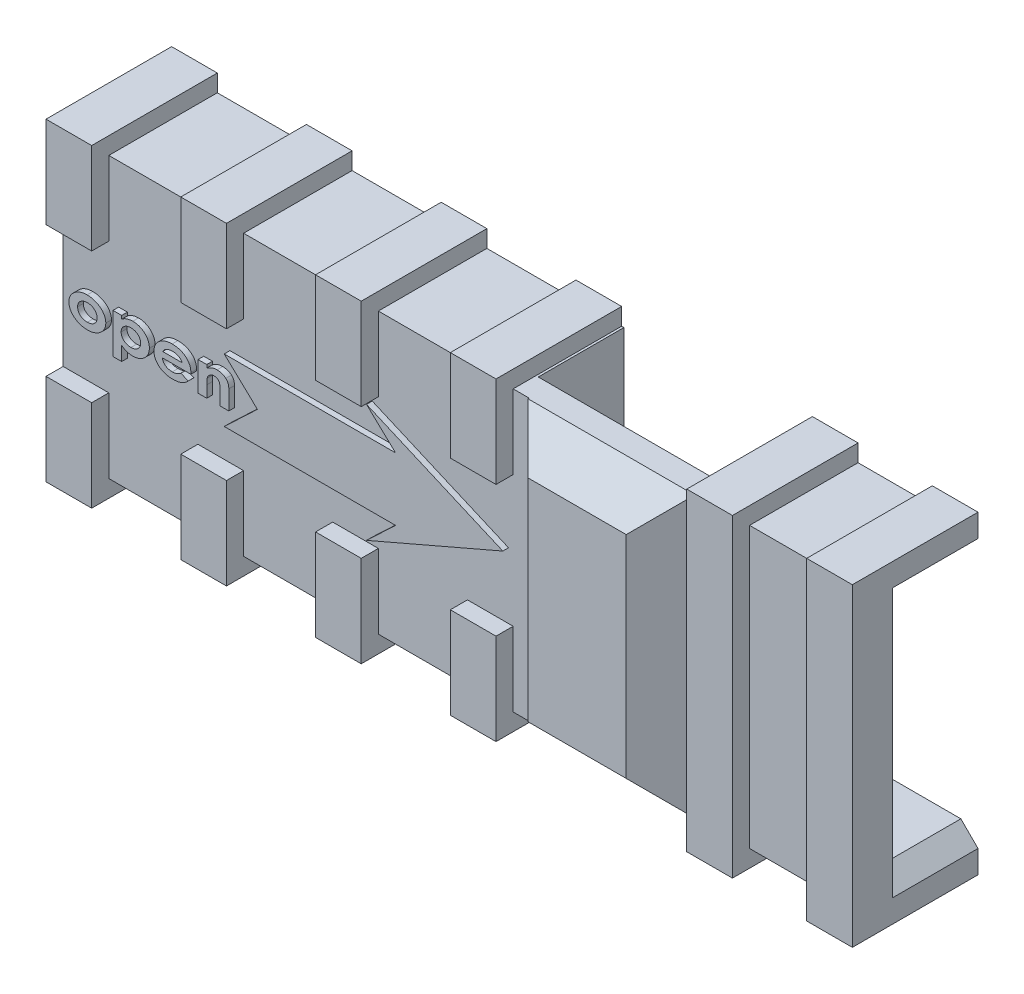
from build123d import *

# Parameters (mm, degrees)
SKETCH1_W                = 55.6
SKETCH1_H                = 24.5
BOSS_EXTRUDE1_DEPTH      = 4.75
SKETCH2_W                = 14.6
SKETCH2_H                = 24.491460156
BOSS_EXTRUDE2_DEPTH      = 3.1
CHAMFER1_SIZE            = 3
SHELL1_T                 = -2
SKETCH3_W                = 16
SKETCH3_H                = 7.5
CUT_EXTRUDE1_DEPTH       = 5.1
SKETCH4_W                = 25
SKETCH4_H                = 3.2
BOSS_EXTRUDE3_DEPTH      = 7.5
SKETCH5_W                = 5.5
SKETCH5_H                = 1.2
CUT_EXTRUDE2_DEPTH       = 43.751900543
BOSS_EXTRUDE6_DEPTH      = 1
BOSS_EXTRUDE6_DEPTH_BACK = 0.8
CUT_EXTRUDE4_DEPTH       = 53.458030844
CHAMFER2_SIZE            = 1.5
BOSS_EXTRUDE7_DEPTH      = 35
FILLET1_R                = 1.5
BOSS_EXTRUDE8_DEPTH      = 0.5
BOSS_EXTRUDE9_DEPTH      = 0.5
SKETCH14_W               = 25
SKETCH14_H               = 1.2
CUT_EXTRUDE5_DEPTH       = 0.3
BOSS_EXTRUDE11_DEPTH     = 25
BOSS_EXTRUDE12_DEPTH     = 25
SKETCH18_W               = 1.3
SKETCH18_H               = 7.95
BOSS_EXTRUDE13_DEPTH     = 8.5
BOSS_EXTRUDE14_DEPTH     = 15
BOSS_EXTRUDE15_DEPTH     = 4
LPATTERN1_START          = -4.75
LPATTERN1_OUTLINE_W      = 4
LPATTERN1_OUTLINE_H      = 1.5
LPATTERN1_DEPTH          = 11
LPATTERN1_START_2        = 4.75
LPATTERN1_2_OUTLINE_W    = 4
LPATTERN1_2_OUTLINE_H    = 6.5
LPATTERN1_2_DEPTH        = 1.5
BOSS_EXTRUDE16_DEPTH     = 4
LPATTERN2_COUNT          = 2
LPATTERN2_PITCH          = 10.5
CHAMFER3_SIZE            = 1.5


# Read off the part's stored shape, not the designer's step: LPattern1
with BuildPart() as part:
    # Sketch1 → Boss-Extrude1 (new, symmetric)
    with BuildSketch(Plane.XY):
        Rectangle(SKETCH1_W, SKETCH1_H)
    extrude(amount=BOSS_EXTRUDE1_DEPTH, both=True)

    # Sketch2 → Boss-Extrude2 (add)
    with BuildSketch(Plane.XY.offset(4.75)):
        with Locations((20.3, 0.004269922)):
            Rectangle(SKETCH2_W, SKETCH2_H)
    extrude(amount=BOSS_EXTRUDE2_DEPTH)

    # Chamfer1
    chamfer1_edges = [part.edges().sort_by_distance(p)[0] for p in [
        (27.6, 0.004269922, 7.85),
        (20.3, 12.25, 7.85),
        (13, 0.004269922, 7.85),
        (20.3, -12.241460156, 7.85),
    ]]
    chamfer(chamfer1_edges, length=CHAMFER1_SIZE)

    # Shell1
    shell1_openings = [part.faces().sort_by_distance(p)[0] for p in [
        (0, 0, -4.75),
        (27.8, 0, 0),
        (-27.8, 0, 0),
    ]]
    offset(amount=SHELL1_T, openings=shell1_openings, kind=Kind.INTERSECTION)

    # Sketch3 → Cut-Extrude1 (cut)
    with BuildSketch(Plane(origin=(0, 12.25, 0), x_dir=(1, 0, 0), z_dir=(0, 1, 0))):
        with Locations((19.8, 1)):
            Rectangle(SKETCH3_W, SKETCH3_H)
    extrude(amount=-CUT_EXTRUDE1_DEPTH, mode=Mode.SUBTRACT)

    # Sketch4 → Boss-Extrude3 (add)
    with BuildSketch(Plane(origin=(0, 0, 2.75), x_dir=(-1, 0, 0), z_dir=(0, 0, -1))):
        with Locations((-0.1, 1.65)):
            Rectangle(SKETCH4_W, SKETCH4_H)
    extrude(amount=BOSS_EXTRUDE3_DEPTH)

    # Sketch5 → Cut-Extrude2 (cut, through all)
    with BuildSketch(Plane.ZY.offset(12.4)):
        with Locations((0, 0.65)):
            Rectangle(SKETCH5_W, SKETCH5_H)
        Polygon((-4.75, 0.05), (-2.863092511, 0.05), (-4.75, 0.884231847), align=None)
        Polygon((-2.75, -0.529898169), (-2.75, 0), (-2.863092511, 0.05), (-4.75, 0.05), (-4.75, -0.529898169), align=None)
    extrude(amount=-CUT_EXTRUDE2_DEPTH, mode=Mode.SUBTRACT)

    # Sketch9 → Boss-Extrude6 (add, two sides: drawn at the far end of the back side and taken through both)
    with BuildSketch(Plane.XZ.offset(-10.25).offset(-BOSS_EXTRUDE6_DEPTH_BACK)):
        Polygon((11.8, 2.75), (11.8, -4.75), (-12.4, -4.75), (-22.6, -4.75), (-22.6, -2.25), (-12.4, -2.25), (-12.4, 2.75), align=None)
    extrude(amount=BOSS_EXTRUDE6_DEPTH + BOSS_EXTRUDE6_DEPTH_BACK)

    # Sketch10 → Cut-Extrude4 (cut, through all)
    with BuildSketch(Plane.ZY.offset(22.6)):
        Polygon((-2.25, 9.25), (-4.75, 10.223803857), (-4.75, 9.25), align=None)
    extrude(amount=-CUT_EXTRUDE4_DEPTH, mode=Mode.SUBTRACT)

    # Chamfer2
    chamfer2_edges = [part.edges().sort_by_distance(p)[0] for p in [
        (-27.8, 10.25, -1),
    ]]
    chamfer(chamfer2_edges, length=CHAMFER2_SIZE)

    # Sketch11 → Boss-Extrude7 (add)
    with BuildSketch(Plane(origin=(12.6, 0, 0), x_dir=(0, 0, -1), z_dir=(1, 0, 0))):
        Polygon((2.55, -10.25), (2.55, -9.25), (4.75, -10.25), (4.75, -10.75), (2.55, -10.75), align=None)
    extrude(amount=-BOSS_EXTRUDE7_DEPTH)

    # Fillet1
    fillet1_edges = [part.edges().sort_by_distance(p)[0] for p in [
        (0.1, 3.25, 2.75),
    ]]
    fillet(fillet1_edges, radius=FILLET1_R)

    # Sketch12 → Boss-Extrude8 (add)
    with BuildSketch(Plane.XY.offset(4.75)):
        Polygon((-13.195407546, 2.75), (1.804592454, 2.75), (-0.737052867, 5.15625), (11.196642534, 0), (-0.737052867, -5.15625), (1.804592454, -2.75), (-13.195407546, -2.75), (-10.290670037, 0), align=None)
    extrude(amount=BOSS_EXTRUDE8_DEPTH)

    # Sketch13 → Boss-Extrude9 (add)
    # profile 1 of 4: a face of its own
    with BuildSketch(Plane.XY.offset(4.75)):
        with BuildLine():
            add(Edge.make_bspline(
                [(-25.198543535, 1.227564103), (-25.16253706, 1.227026087), (-25.090893167, 1.22595557), (-24.984155569, 1.217316685), (-24.879150552, 1.203143918), (-24.775532798, 1.184562687), (-24.673793293, 1.159050398), (-24.573733894, 1.128105432), (-24.474918114, 1.092537833), (-24.379032437, 1.050362204), (-24.285903707, 1.004480708), (-24.197466101, 0.954149845), (-24.114788959, 0.8992749), (-24.036821025, 0.841029499), (-23.965243494, 0.77760954), (-23.896985694, 0.711902981), (-23.835623535, 0.640874275), (-23.77954312, 0.566538171), (-23.729111603, 0.489876202), (-23.685419495, 0.410828996), (-23.648258435, 0.330498826), (-23.617893053, 0.248423141), (-23.593903929, 0.165044822), (-23.577092027, 0.079910674), (-23.567107315, -0.006638519), (-23.565658141, -0.064811429), (-23.564929753, -0.094050481)],
                knots=[0, 0, 0, 0, 1.11282745, 2.214248718, 3.3073953, 4.387044838, 5.466283472, 6.547068225, 7.623401901, 8.710421146, 9.782966613, 10.83127689, 11.853068892, 12.848501143, 13.836567125, 14.807129212, 15.774810607, 16.734124436, 17.683816456, 18.608564961, 19.523271112, 20.416941416, 21.310961996, 22.202059403, 23.096313424, 24, 24, 24, 24], degree=3))
            add(Edge.make_bspline(
                [(-23.564929753, -0.094050481), (-23.565658886, -0.123522776), (-23.567109571, -0.182160874), (-23.577083434, -0.269412481), (-23.593932846, -0.355231243), (-23.617857089, -0.439652501), (-23.648835931, -0.522296335), (-23.686280019, -0.603647308), (-23.73067421, -0.683323032), (-23.780567508, -0.761832753), (-23.837847888, -0.836209358), (-23.898296683, -0.908424722), (-23.965731888, -0.974798028), (-24.036827534, -1.038211293), (-24.113658215, -1.096181697), (-24.194830668, -1.150573418), (-24.280797681, -1.201063663), (-24.371851953, -1.246341287), (-24.466309772, -1.286726694), (-24.563246718, -1.322860459), (-24.662817669, -1.352839177), (-24.764852418, -1.377510198), (-24.869274128, -1.396415747), (-24.976039807, -1.409410625), (-25.085044146, -1.418361582), (-25.158561302, -1.419364578), (-25.195739048, -1.419871795)],
                knots=[0, 0, 0, 0, 0.909223817, 1.808992312, 2.705519222, 3.604825348, 4.512876213, 5.425894602, 6.3650458, 7.325083872, 8.292727501, 9.259376648, 10.228094243, 11.208918944, 12.1967683, 13.194671296, 14.222322225, 15.270311755, 16.329748051, 17.390557501, 18.460346683, 19.535879317, 20.627723368, 21.732231364, 22.853185712, 24, 24, 24, 24], degree=3))
            add(Edge.make_bspline(
                [(-25.195739048, -1.419871795), (-25.2500033, -1.418574177), (-25.356714026, -1.416022409), (-25.513911629, -1.398408376), (-25.664938705, -1.368258362), (-25.809946748, -1.326132893), (-25.949031701, -1.272025256), (-26.081534234, -1.205008624), (-26.208782749, -1.126904659), (-26.327888138, -1.037095232), (-26.437640011, -0.939628116), (-26.532708094, -0.834339769), (-26.614113203, -0.724775746), (-26.680728484, -0.609626994), (-26.732299532, -0.4890704), (-26.768509138, -0.363294339), (-26.792235945, -0.232598734), (-26.794533558, -0.143467517), (-26.795698984, -0.098257212)],
                knots=[0, 0, 0, 0, 1.13037456, 2.222883093, 3.290371038, 4.334986959, 5.364770941, 6.394646991, 7.424235301, 8.470993352, 9.498380662, 10.477280453, 11.420855446, 12.336949679, 13.242176764, 14.145017838, 15.059091615, 16, 16, 16, 16], degree=3))
            add(Edge.make_bspline(
                [(-26.795698984, -0.098257212), (-26.794076245, -0.05000875), (-26.790880031, 0.045023472), (-26.765712661, 0.184317199), (-26.72411595, 0.317451552), (-26.665331659, 0.444255163), (-26.590449772, 0.565210786), (-26.498255499, 0.678971699), (-26.390368447, 0.787398087), (-26.308453541, 0.851677885), (-26.266352028, 0.884715545)],
                knots=[0, 0, 0, 0, 0.996992023, 1.963717908, 2.915734652, 3.873423307, 4.845483175, 5.849056382, 6.894487165, 8, 8, 8, 8], degree=3))
            add(Edge.make_bspline(
                [(-26.266352028, 0.884715545), (-26.227314474, 0.912302797), (-26.149879894, 0.967024649), (-26.026254798, 1.036154717), (-25.89904477, 1.095352543), (-25.767404595, 1.144192023), (-25.631186029, 1.181006296), (-25.490815741, 1.207762634), (-25.346172622, 1.224267869), (-25.248132746, 1.226456884), (-25.198543535, 1.227564103)],
                knots=[0, 0, 0, 0, 1.004823229, 1.993159313, 2.974022723, 3.953813955, 4.942382268, 5.938256273, 6.957156536, 8, 8, 8, 8], degree=3))
        make_face()
        with BuildLine():
            add(Edge.make_bspline(
                [(-25.181716612, 0.644230769), (-25.211644275, 0.643427177), (-25.270236367, 0.641853912), (-25.356281356, 0.633358971), (-25.437847515, 0.615719999), (-25.516317275, 0.593919259), (-25.590518964, 0.563782741), (-25.662172183, 0.529340488), (-25.728446066, 0.485932389), (-25.790761498, 0.437850795), (-25.847711197, 0.385047387), (-25.896495939, 0.327073848), (-25.939657373, 0.266797502), (-25.972948967, 0.201490544), (-26.000107628, 0.133298854), (-26.018696967, 0.060961246), (-26.031308026, -0.014614744), (-26.032350623, -0.066420144), (-26.032878471, -0.092648237)],
                knots=[0, 0, 0, 0, 1.141407707, 2.234637035, 3.290140179, 4.319480612, 5.335428471, 6.339624966, 7.345598836, 8.349043939, 9.338746116, 10.299423449, 11.233789626, 12.158418107, 13.086688811, 14.026857639, 15.001035382, 16, 16, 16, 16], degree=3))
            add(Edge.make_bspline(
                [(-26.032878471, -0.092648237), (-26.032288374, -0.119798495), (-26.031133339, -0.17294148), (-26.019640418, -0.250528929), (-26.000692414, -0.324134031), (-25.973971094, -0.393710765), (-25.939884429, -0.459377519), (-25.899292228, -0.521813401), (-25.849662896, -0.579122107), (-25.793547238, -0.632436428), (-25.731773387, -0.68038569), (-25.665048751, -0.721900757), (-25.594991734, -0.758109179), (-25.520286037, -0.786552676), (-25.441973545, -0.809146052), (-25.359669113, -0.82537536), (-25.273289638, -0.834213415), (-25.214454312, -0.835754444), (-25.184521099, -0.836538462)],
                knots=[0, 0, 0, 0, 1.029202734, 2.014526202, 2.96696449, 3.90694664, 4.834644214, 5.768882826, 6.724574225, 7.702694354, 8.700931557, 9.684698777, 10.679743001, 11.687186518, 12.711184654, 13.768146065, 14.864516221, 16, 16, 16, 16], degree=3))
            add(Edge.make_bspline(
                [(-25.184521099, -0.836538462), (-25.154579114, -0.835838419), (-25.095701043, -0.834461852), (-25.009192675, -0.824399847), (-24.92640436, -0.808417825), (-24.84736289, -0.786202189), (-24.772682958, -0.756316074), (-24.701681441, -0.720665957), (-24.634459746, -0.67824315), (-24.571956407, -0.629423754), (-24.514653308, -0.575925866), (-24.464261588, -0.518108673), (-24.422080139, -0.456117728), (-24.387465763, -0.390519744), (-24.360585943, -0.321349111), (-24.341914343, -0.248364245), (-24.329288575, -0.17184586), (-24.328268779, -0.119343136), (-24.327750266, -0.092648237)],
                knots=[0, 0, 0, 0, 1.131896637, 2.225767246, 3.288061208, 4.317317735, 5.324799949, 6.324580361, 7.317425251, 8.324907466, 9.318852724, 10.277285545, 11.218413819, 12.147266526, 13.076035169, 14.016914522, 14.991704378, 16, 16, 16, 16], degree=3))
            add(Edge.make_bspline(
                [(-24.327750266, -0.092648237), (-24.328347465, -0.065964547), (-24.329521235, -0.013518867), (-24.341017119, 0.063124589), (-24.35977601, 0.135878843), (-24.386885655, 0.204357513), (-24.420631235, 0.269419048), (-24.462132986, 0.3307333), (-24.511857079, 0.38756258), (-24.567477715, 0.440696096), (-24.629489014, 0.488290727), (-24.695761616, 0.530349672), (-24.766722059, 0.565777721), (-24.84173372, 0.59428559), (-24.920772366, 0.616822109), (-25.003994017, 0.633131877), (-25.091551116, 0.641892941), (-25.151317021, 0.643442563), (-25.181716612, 0.644230769)],
                knots=[0, 0, 0, 0, 1.012249738, 1.989534617, 2.934103707, 3.858249317, 4.778768889, 5.711264169, 6.660943005, 7.639796787, 8.626338021, 9.623076436, 10.614868228, 11.631345954, 12.664638796, 13.731098634, 14.845936138, 16, 16, 16, 16], degree=3))
        make_face(mode=Mode.SUBTRACT)
    # profile 2 of 4: a face of its own
    with BuildSketch(Plane.XY.offset(4.75)):
        with BuildLine():
            Line((-22.173904112, 1.182692308), (-22.173904112, 0.89453125))
            add(Edge.make_bspline(
                [(-22.173904112, 0.89453125), (-22.138614858, 0.921383012), (-22.068917484, 0.974416076), (-21.956757995, 1.041729403), (-21.841425338, 1.099591475), (-21.721058457, 1.145906623), (-21.596849055, 1.182670137), (-21.467977571, 1.208124137), (-21.335121299, 1.225230865), (-21.244972427, 1.226780019), (-21.199344817, 1.227564103)],
                knots=[0, 0, 0, 0, 1.012747239, 2.000207279, 2.984324867, 3.958346284, 4.943680621, 5.940886277, 6.957807956, 8, 8, 8, 8], degree=3))
            add(Edge.make_bspline(
                [(-21.199344817, 1.227564103), (-21.14998039, 1.226570455), (-21.052798734, 1.224614304), (-20.909881285, 1.206646719), (-20.772705932, 1.177127208), (-20.64083853, 1.136612852), (-20.51498658, 1.08355413), (-20.394434102, 1.019862421), (-20.280253769, 0.94319759), (-20.172652236, 0.85654248), (-20.073879842, 0.760926975), (-19.986817215, 0.657832558), (-19.914720309, 0.54686664), (-19.854181124, 0.43046727), (-19.807700961, 0.306865689), (-19.775262576, 0.176498597), (-19.753879716, 0.039866167), (-19.751856592, -0.053536595), (-19.750827189, -0.101061699)],
                knots=[0, 0, 0, 0, 1.078865593, 2.123916998, 3.143105393, 4.143472405, 5.135097956, 6.124826161, 7.119632155, 8.137038762, 9.141533593, 10.120867323, 11.080271918, 12.028619564, 12.984248008, 13.95952142, 14.961765637, 16, 16, 16, 16], degree=3))
            add(Edge.make_bspline(
                [(-19.750827189, -0.101061699), (-19.752207038, -0.146940876), (-19.754931279, -0.237520308), (-19.775549745, -0.370453337), (-19.80997152, -0.497423579), (-19.85826503, -0.618404254), (-19.919462915, -0.734074501), (-19.994918096, -0.843977659), (-20.084879693, -0.947257549), (-20.186423823, -1.043828657), (-20.297327355, -1.131248822), (-20.413737846, -1.209316091), (-20.536578709, -1.273601456), (-20.66377601, -1.327343526), (-20.796207151, -1.368882852), (-20.933565841, -1.397906669), (-21.075868251, -1.417186448), (-21.172637659, -1.418967375), (-21.221780714, -1.419871795)],
                knots=[0, 0, 0, 0, 1.001881625, 1.97801867, 2.930357922, 3.869802929, 4.817533662, 5.783242783, 6.774954085, 7.804051867, 8.839713, 9.856313399, 10.861104155, 11.86325887, 12.869151335, 13.887455066, 14.927172189, 16, 16, 16, 16], degree=3))
            add(Edge.make_bspline(
                [(-21.221780714, -1.419871795), (-21.265531308, -1.418986584), (-21.351650732, -1.417244121), (-21.478405079, -1.401736204), (-21.600806567, -1.37855356), (-21.719144745, -1.343786011), (-21.834680004, -1.297419318), (-21.949263882, -1.239727447), (-22.063478469, -1.169282306), (-22.136470424, -1.114323346), (-22.173904112, -1.086137821)],
                knots=[0, 0, 0, 0, 1.019490905, 2.006783484, 2.972664642, 3.920837072, 4.876865352, 5.870928907, 6.908112761, 8, 8, 8, 8], degree=3))
            Line((-22.173904112, -1.086137821), (-22.173904112, -2.317307692))
            Line((-22.173904112, -2.317307692), (-22.936724625, -2.317307692))
            Line((-22.936724625, -2.317307692), (-22.936724625, 1.182692308))
            Line((-22.936724625, 1.182692308), (-22.173904112, 1.182692308))
        make_face()
        with BuildLine():
            add(Edge.make_bspline(
                [(-21.362005073, 0.644230769), (-21.392170971, 0.643450725), (-21.451238202, 0.641923337), (-21.538097495, 0.633075821), (-21.62071319, 0.61659297), (-21.700018894, 0.595216955), (-21.775041026, 0.566268429), (-21.846244874, 0.531200463), (-21.91320888, 0.489383355), (-21.975920251, 0.442304614), (-22.032725054, 0.389649378), (-22.082834627, 0.333143354), (-22.124307303, 0.272030003), (-22.159422453, 0.207754881), (-22.185889459, 0.138827419), (-22.204540781, 0.06610025), (-22.217285136, -0.010171481), (-22.218271947, -0.062446159), (-22.218775907, -0.089142628)],
                knots=[0, 0, 0, 0, 1.146312734, 2.244571697, 3.312068122, 4.343961255, 5.361426987, 6.362132716, 7.355126752, 8.356738151, 9.336945637, 10.293377109, 11.219443221, 12.137170656, 13.070487838, 14.015975039, 14.986766366, 16, 16, 16, 16], degree=3))
            add(Edge.make_bspline(
                [(-22.218775907, -0.089142628), (-22.21825868, -0.116304511), (-22.217241215, -0.169736171), (-22.204590613, -0.247642816), (-22.186063002, -0.321833781), (-22.159077715, -0.391920981), (-22.124527477, -0.457851949), (-22.083077903, -0.520465154), (-22.032494509, -0.577706116), (-21.976210886, -0.631846221), (-21.913172056, -0.679497934), (-21.846445344, -0.722175848), (-21.775049109, -0.757253103), (-21.699772462, -0.785712412), (-21.620976804, -0.809360654), (-21.538059217, -0.825248525), (-21.45124838, -0.834266922), (-21.392174411, -0.835770551), (-21.362005073, -0.836538462)],
                knots=[0, 0, 0, 0, 1.02193228, 2.010300123, 2.964531969, 3.897873934, 4.830883838, 5.763395428, 6.71807368, 7.701727499, 8.699883524, 9.688839039, 10.680766746, 11.68930744, 12.716984781, 13.775117307, 14.863742528, 16, 16, 16, 16], degree=3))
            add(Edge.make_bspline(
                [(-21.362005073, -0.836538462), (-21.332762802, -0.835841372), (-21.27528013, -0.834471077), (-21.190877868, -0.824375706), (-21.109642107, -0.808418207), (-21.032135633, -0.785477419), (-20.958408446, -0.755460893), (-20.887905815, -0.71991223), (-20.821302314, -0.676713179), (-20.758267272, -0.628104414), (-20.701507215, -0.573790402), (-20.650769299, -0.516072706), (-20.608831536, -0.453803941), (-20.573205198, -0.388625798), (-20.546536932, -0.319216836), (-20.527797048, -0.246268853), (-20.515227208, -0.16997176), (-20.514178573, -0.11770569), (-20.513647701, -0.091245994)],
                knots=[0, 0, 0, 0, 1.112570003, 2.18702221, 3.230023115, 4.25989823, 5.257392698, 6.255719385, 7.259773528, 8.273782625, 9.280275801, 10.244917744, 11.192143032, 12.131191769, 13.065977357, 14.012952112, 14.994057057, 16, 16, 16, 16], degree=3))
            add(Edge.make_bspline(
                [(-20.513647701, -0.091245994), (-20.514257376, -0.065031021), (-20.515460775, -0.01328685), (-20.526884563, 0.06244308), (-20.545833446, 0.134659032), (-20.572584299, 0.202822198), (-20.606741101, 0.267442523), (-20.648032472, 0.328611837), (-20.697755853, 0.385710214), (-20.754326694, 0.438553872), (-20.81634464, 0.486594075), (-20.882657964, 0.529012486), (-20.952784286, 0.564935734), (-21.027235308, 0.593503493), (-21.10513002, 0.617043407), (-21.187348043, 0.632944487), (-21.273461362, 0.641959375), (-21.33206931, 0.643462833), (-21.362005073, 0.644230769)],
                knots=[0, 0, 0, 0, 1.000969768, 1.975754516, 2.917810478, 3.847944434, 4.766522411, 5.705060142, 6.660892776, 7.652581512, 8.658040758, 9.653700516, 10.655943682, 11.662353867, 12.696269225, 13.760877537, 14.856301227, 16, 16, 16, 16], degree=3))
        make_face(mode=Mode.SUBTRACT)
    # profile 3 of 4: a face of its own
    with BuildSketch(Plane.XY.offset(4.75)):
        with BuildLine():
            Line((-16.119016291, -0.253205128), (-18.629032317, -0.253205128))
            add(Edge.make_bspline(
                [(-18.629032317, -0.253205128), (-18.624170557, -0.276712977), (-18.61455915, -0.323186582), (-18.591368296, -0.389746417), (-18.56441494, -0.453157255), (-18.531183326, -0.512736103), (-18.491548993, -0.567905833), (-18.447274348, -0.620504445), (-18.396672591, -0.668520555), (-18.340993281, -0.713084907), (-18.280367219, -0.752640189), (-18.215468935, -0.78735844), (-18.146292738, -0.815978749), (-18.073145274, -0.839812897), (-17.996077357, -0.858765767), (-17.91497324, -0.87203929), (-17.829902064, -0.879697249), (-17.771809648, -0.880830796), (-17.742113246, -0.881410256)],
                knots=[0, 0, 0, 0, 0.969018686, 1.915691733, 2.841985404, 3.750979999, 4.665452283, 5.583234356, 6.524995966, 7.479222437, 8.461449911, 9.445808771, 10.449013038, 11.482302364, 12.551935853, 13.652674955, 14.800065296, 16, 16, 16, 16], degree=3))
            add(Edge.make_bspline(
                [(-17.742113246, -0.881410256), (-17.706546088, -0.880649924), (-17.636351798, -0.879149354), (-17.533027192, -0.865802684), (-17.433053097, -0.846209115), (-17.337545331, -0.816191482), (-17.245634969, -0.779062155), (-17.157763741, -0.733068608), (-17.073084571, -0.679397247), (-17.020963644, -0.637023165), (-16.994717413, -0.615685096)],
                knots=[0, 0, 0, 0, 1.052749053, 2.077674323, 3.080682619, 4.065743114, 5.037316202, 6.012358458, 6.999094951, 8, 8, 8, 8], degree=3))
            Line((-16.994717413, -0.615685096), (-16.340570778, -0.865985577))
            add(Edge.make_bspline(
                [(-16.340570778, -0.865985577), (-16.360849037, -0.888926631), (-16.401273308, -0.934659128), (-16.466795964, -0.99814812), (-16.534630508, -1.057909268), (-16.605656272, -1.11296686), (-16.680263525, -1.162498714), (-16.757260466, -1.208368297), (-16.837576032, -1.248859569), (-16.920435889, -1.285713405), (-17.007198284, -1.317260415), (-17.097706765, -1.344221775), (-17.191777726, -1.368584069), (-17.290208857, -1.38713258), (-17.392441265, -1.401843195), (-17.498649573, -1.412267553), (-17.608819287, -1.418718131), (-17.683677389, -1.419482649), (-17.721780714, -1.419871795)],
                knots=[0, 0, 0, 0, 0.954251611, 1.902279988, 2.841984272, 3.771778272, 4.701343864, 5.632279066, 6.564211674, 7.503746464, 8.45802589, 9.439942697, 10.44721276, 11.486058028, 12.560770686, 13.666381068, 14.812170774, 16, 16, 16, 16], degree=3))
            add(Edge.make_bspline(
                [(-17.721780714, -1.419871795), (-17.780486823, -1.418903079), (-17.895136338, -1.417011235), (-18.062985241, -1.399068068), (-18.222373291, -1.369757078), (-18.373824649, -1.329305337), (-18.516875585, -1.276709063), (-18.651331011, -1.211630361), (-18.778199946, -1.136207366), (-18.894596188, -1.048536654), (-19.000335843, -0.952896839), (-19.093635671, -0.850566319), (-19.171765527, -0.741475744), (-19.235571627, -0.626603432), (-19.285792901, -0.506034337), (-19.32156393, -0.379221463), (-19.343077631, -0.246462334), (-19.345666783, -0.156062953), (-19.346981035, -0.110176282)],
                knots=[0, 0, 0, 0, 1.20790374, 2.358963644, 3.469347683, 4.540449611, 5.581372964, 6.601087989, 7.61075946, 8.614109864, 9.594791716, 10.541503829, 11.458497709, 12.349879101, 13.240455541, 14.140322596, 15.056028864, 16, 16, 16, 16], degree=3))
            add(Edge.make_bspline(
                [(-19.346981035, -0.110176282), (-19.345654177, -0.063126105), (-19.343039563, 0.029587654), (-19.321767091, 0.165423116), (-19.285652382, 0.294937932), (-19.23550781, 0.418400537), (-19.171646858, 0.536019525), (-19.092694197, 0.646794312), (-19.00043378, 0.751898206), (-18.894188405, 0.849023719), (-18.777559574, 0.937745286), (-18.652818258, 1.015683306), (-18.520625113, 1.081448162), (-18.381003855, 1.134554754), (-18.234527523, 1.176950052), (-18.08047802, 1.205759722), (-17.919747674, 1.224899977), (-17.809945924, 1.226665207), (-17.754032317, 1.227564103)],
                knots=[0, 0, 0, 0, 0.97207724, 1.915506802, 2.833123574, 3.745334152, 4.663967392, 5.592704133, 6.551015148, 7.549179786, 8.562584814, 9.575840184, 10.584630201, 11.609049206, 12.659344037, 13.731698836, 14.844928245, 16, 16, 16, 16], degree=3))
            add(Edge.make_bspline(
                [(-17.754032317, 1.227564103), (-17.694861043, 1.22658202), (-17.579050893, 1.224659884), (-17.409548461, 1.206841103), (-17.248577177, 1.177362029), (-17.09550747, 1.137260625), (-16.951796955, 1.083440686), (-16.815649585, 1.019675878), (-16.688795725, 0.94297681), (-16.57098834, 0.855589909), (-16.464775292, 0.758576781), (-16.37125931, 0.653609423), (-16.292162852, 0.540683494), (-16.227314889, 0.420271221), (-16.176950837, 0.292250223), (-16.142547832, 0.156509519), (-16.119748299, 0.013521369), (-16.117407152, -0.084610948), (-16.116211804, -0.134715545)],
                knots=[0, 0, 0, 0, 1.187137645, 2.323468483, 3.415369378, 4.468802684, 5.494176065, 6.490655582, 7.481568224, 8.463640372, 9.42963447, 10.36320726, 11.27916759, 12.189841763, 13.101686585, 14.03217969, 14.995266307, 16, 16, 16, 16], degree=3))
            Line((-16.116211804, -0.134715545), (-16.119016291, -0.253205128))
        make_face()
        with BuildLine():
            add(Edge.make_bspline(
                [(-16.879032317, 0.240384615), (-16.885942671, 0.256671723), (-16.89981032, 0.289356572), (-16.926854391, 0.335768362), (-16.958597576, 0.379876785), (-16.994305258, 0.422251651), (-17.035224483, 0.461665826), (-17.081448516, 0.498066188), (-17.131553318, 0.533120308), (-17.205258271, 0.576323901), (-17.305219601, 0.622139673), (-17.434828337, 0.661576955), (-17.57370313, 0.684880491), (-17.669340576, 0.687673482), (-17.718275105, 0.689102564)],
                knots=[0, 0, 0, 0, 0.631464223, 1.26721781, 1.913516375, 2.57088003, 3.243905501, 3.938785967, 4.670545689, 5.42647598, 6.987859369, 8.585443137, 10.252883791, 12, 12, 12, 12], degree=3))
            add(Edge.make_bspline(
                [(-17.718275105, 0.689102564), (-17.745395228, 0.688693195), (-17.79877592, 0.68788743), (-17.877500285, 0.681684628), (-17.953538567, 0.670235937), (-18.027097712, 0.654974114), (-18.098069869, 0.635314317), (-18.166553533, 0.611419377), (-18.232445685, 0.582859624), (-18.274417324, 0.560167571), (-18.295298343, 0.548878205)],
                knots=[0, 0, 0, 0, 1.08379122, 2.133232499, 3.152951654, 4.15493671, 5.133846068, 6.093859258, 7.05168915, 8, 8, 8, 8], degree=3))
            add(Edge.make_bspline(
                [(-18.295298343, 0.548878205), (-18.321385215, 0.532389079), (-18.375911706, 0.497923691), (-18.449148463, 0.427011782), (-18.520520765, 0.341025522), (-18.562242749, 0.275045725), (-18.584160522, 0.240384615)],
                knots=[0, 0, 0, 0, 0.865267037, 1.808571556, 2.848778815, 4, 4, 4, 4], degree=3))
            Line((-18.584160522, 0.240384615), (-16.879032317, 0.240384615))
        make_face(mode=Mode.SUBTRACT)
    # profile 4 of 4: a face of its own
    with BuildSketch(Plane.XY.offset(4.75)):
        with BuildLine():
            Line((-15.488006676, 1.182692308), (-14.725186163, 1.182692308))
            Line((-14.725186163, 1.182692308), (-14.725186163, 0.912059295))
            add(Edge.make_bspline(
                [(-14.725186163, 0.912059295), (-14.68348149, 0.939983326), (-14.603416746, 0.993591956), (-14.482481138, 1.06147536), (-14.368169134, 1.116835909), (-14.258448585, 1.159249776), (-14.150782246, 1.189605169), (-14.043440362, 1.211247977), (-13.934929271, 1.22535491), (-13.862148217, 1.226826212), (-13.8256469, 1.227564103)],
                knots=[0, 0, 0, 0, 1.24259559, 2.385538374, 3.431444507, 4.385979086, 5.294719049, 6.198283071, 7.096398902, 8, 8, 8, 8], degree=3))
            add(Edge.make_bspline(
                [(-13.8256469, 1.227564103), (-13.788693839, 1.226708305), (-13.716227369, 1.225030051), (-13.609392679, 1.213210156), (-13.507054815, 1.191818508), (-13.408517604, 1.163506794), (-13.314863218, 1.125836382), (-13.224997217, 1.080807802), (-13.139439679, 1.027082562), (-13.086527419, 0.985015237), (-13.0600219, 0.963942308)],
                knots=[0, 0, 0, 0, 1.072451155, 2.103120794, 3.114095873, 4.103567927, 5.074666378, 6.039276427, 7.017808036, 8, 8, 8, 8], degree=3))
            add(Edge.make_bspline(
                [(-13.0600219, 0.963942308), (-13.038956532, 0.944562176), (-12.99696983, 0.905934424), (-12.942932671, 0.839347162), (-12.896794709, 0.76650416), (-12.859588456, 0.686575597), (-12.830773075, 0.599743639), (-12.811001485, 0.5061154), (-12.797880774, 0.406218176), (-12.796439282, 0.337417116), (-12.795698984, 0.302083333)],
                knots=[0, 0, 0, 0, 0.931730763, 1.857090857, 2.784610633, 3.73510575, 4.722471135, 5.759120176, 6.849163661, 8, 8, 8, 8], degree=3))
            Line((-12.795698984, 0.302083333), (-12.795698984, -1.375))
            Line((-12.795698984, -1.375), (-13.558519496, -1.375))
            Line((-13.558519496, -1.375), (-13.558519496, -0.264423077))
            add(Edge.make_bspline(
                [(-13.558519496, -0.264423077), (-13.558672971, -0.228198758), (-13.558967077, -0.158781575), (-13.560653281, -0.059413045), (-13.565346895, 0.030302355), (-13.569615431, 0.110561651), (-13.576722293, 0.181162906), (-13.584869451, 0.242255988), (-13.594518647, 0.29379449), (-13.608866606, 0.349192764), (-13.633655997, 0.408220742), (-13.670286117, 0.471348953), (-13.718655521, 0.523696522), (-13.774553743, 0.567870747), (-13.838787618, 0.602050454), (-13.910161023, 0.626854199), (-13.988633463, 0.641659194), (-14.043396446, 0.643353718), (-14.07174065, 0.644230769)],
                knots=[0, 0, 0, 0, 1.44217274, 2.763656378, 3.955894824, 5.018565234, 5.962878823, 6.780003285, 7.471583702, 8.049340492, 9.054920332, 10.010714806, 10.939499816, 11.873860374, 12.835478924, 13.821235586, 14.872315934, 16, 16, 16, 16], degree=3))
            add(Edge.make_bspline(
                [(-14.07174065, 0.644230769), (-14.108557457, 0.642570372), (-14.180425427, 0.639329205), (-14.284330521, 0.61525679), (-14.379819782, 0.573802566), (-14.466269782, 0.516720945), (-14.54241656, 0.445602585), (-14.606135069, 0.361267302), (-14.658550387, 0.265077067), (-14.680799305, 0.194118946), (-14.692233439, 0.157652244)],
                knots=[0, 0, 0, 0, 1.037209767, 2.024677517, 2.986501624, 3.956635865, 4.930675879, 5.908251037, 6.925011177, 8, 8, 8, 8], degree=3))
            add(Edge.make_bspline(
                [(-14.692233439, 0.157652244), (-14.694935133, 0.146227494), (-14.700962289, 0.120740239), (-14.707704354, 0.077881292), (-14.713183345, 0.02663771), (-14.717111713, -0.033254619), (-14.720564614, -0.101972741), (-14.723481399, -0.179331612), (-14.724621116, -0.265354798), (-14.724991574, -0.325420653), (-14.725186163, -0.356971154)],
                knots=[0, 0, 0, 0, 0.545196226, 1.216267763, 2.013519566, 2.938597919, 4.003895383, 5.209722601, 6.534364476, 8, 8, 8, 8], degree=3))
            Line((-14.725186163, -0.356971154), (-14.725186163, -1.375))
            Line((-14.725186163, -1.375), (-15.488006676, -1.375))
            Line((-15.488006676, -1.375), (-15.488006676, 1.182692308))
        make_face()
    extrude(amount=BOSS_EXTRUDE9_DEPTH)

    # Sketch14 → Cut-Extrude5 (cut)
    with BuildSketch(Plane.XY.offset(-2.75)):
        with Locations((0.1, 0.65)):
            Rectangle(SKETCH14_W, SKETCH14_H)
    extrude(amount=-CUT_EXTRUDE5_DEPTH, mode=Mode.SUBTRACT)

    # Sketch16 → Boss-Extrude11 (add)
    with BuildSketch(Plane.ZY.offset(12.4)):
        Polygon((-4.75, 0.884231847), (-5.05, 1.016866624), (-5.05, 3.25), (-4.75, 3.25), (-4.45, 3.25), (-4.45, 0.884231847), align=None)
    extrude(amount=-BOSS_EXTRUDE11_DEPTH)

    # Sketch17 → Boss-Extrude12 (add)
    with BuildSketch(Plane.ZY.offset(12.4)):
        Polygon((-5.05, 1.016866624), (-3.05, 0.132634777), (-3.05, -0.632726954), (-5.05, 0.251504893), align=None)
    extrude(amount=-BOSS_EXTRUDE12_DEPTH)

    # Sketch18 → Boss-Extrude13 (add)
    with BuildSketch(Plane(origin=(0, 0, -4.75), x_dir=(-1, 0, 0), z_dir=(0, 0, -1))):
        with Locations((11.75, 6.975)):
            Rectangle(SKETCH18_W, SKETCH18_H)
        with Locations((-11.15, 6.975)):
            Rectangle(SKETCH18_W, SKETCH18_H)
    extrude(amount=-BOSS_EXTRUDE13_DEPTH)

    # Sketch19 → Boss-Extrude14 (add)
    with BuildSketch(Plane(origin=(27.8, 0, 0), x_dir=(0, 0, -1), z_dir=(1, 0, 0))):
        Polygon((-2.75, 12.25), (4.75, 12.25), (4.75, 10.25), (-2.75, 10.25), (-2.75, -10.25), (4.75, -10.25), (4.75, -12.25), (-4.75, -12.25), (-4.75, 12.25), align=None)
    extrude(amount=BOSS_EXTRUDE14_DEPTH)

    # Sketch20 → Boss-Extrude15 (add)
    with BuildSketch(Plane.ZY.offset(27.8)):
        Polygon((-4.75, 12.05), (4.55, 12.05), (4.55, 5.75), (6.25, 5.75), (6.25, 12.05), (6.25, 13.75), (-4.75, 13.75), align=None)
    boss_extrude15 = extrude(amount=-BOSS_EXTRUDE15_DEPTH)

    # LPattern1 outline → LPattern1 (add)
    with BuildSketch(Plane.XY.offset(LPATTERN1_START)):
        with Locations((9.6, 13)):
            Rectangle(LPATTERN1_OUTLINE_W, LPATTERN1_OUTLINE_H)
        with Locations((-2.2, 13)):
            Rectangle(LPATTERN1_OUTLINE_W, LPATTERN1_OUTLINE_H)
        with Locations((-14, 13)):
            Rectangle(LPATTERN1_OUTLINE_W, LPATTERN1_OUTLINE_H)
    lpattern1 = extrude(amount=LPATTERN1_DEPTH)

    # LPattern1 2 outline → LPattern1 2 (add)
    with BuildSketch(Plane.XY.offset(LPATTERN1_START_2)):
        with Locations((-14, 9)):
            Rectangle(LPATTERN1_2_OUTLINE_W, LPATTERN1_2_OUTLINE_H)
        with Locations((9.6, 9)):
            Rectangle(LPATTERN1_2_OUTLINE_W, LPATTERN1_2_OUTLINE_H)
        with Locations((-2.2, 9)):
            Rectangle(LPATTERN1_2_OUTLINE_W, LPATTERN1_2_OUTLINE_H)
    lpattern1_2 = extrude(amount=LPATTERN1_2_DEPTH)

    # Mirror1: Boss-Extrude15, LPattern1, LPattern1 2 across plane
    add(boss_extrude15.mirror(Plane.ZX))
    add(lpattern1.mirror(Plane.ZX))
    add(lpattern1_2.mirror(Plane.ZX))

    # Sketch21 → Boss-Extrude16 (add)
    with BuildSketch(Plane(origin=(42.8, 0, 0), x_dir=(0, 0, -1), z_dir=(1, 0, 0))):
        Polygon((4.75, 12.05), (4.75, 12.25), (-4.75, 12.25), (-4.75, 5.75), (-4.55, 5.75), (-4.55, 12.05), align=None)
        Polygon((-4.75, 12.25), (4.75, 12.25), (4.75, 13.75), (-6.25, 13.75), (-6.25, 5.75), (-4.75, 5.75), align=None)
        Polygon((-4.55, 5.75), (-4.75, 5.75), (-6.25, 5.75), (-6.25, 0), (-4.55, 0), align=None)
        Polygon((-4.55, -5.75), (-4.55, 0), (-6.25, 0), (-6.25, -5.75), (-6.25, -13.75), (4.75, -13.75), (4.75, -12.25), (4.75, -12.05), (-4.55, -12.05), align=None)
    boss_extrude16 = extrude(amount=-BOSS_EXTRUDE16_DEPTH)

    # LPattern2: Boss-Extrude16 ×2
    with Locations(*[(-i * LPATTERN2_PITCH, 0, 0) for i in range(1, LPATTERN2_COUNT)]):
        add(boss_extrude16)

    # Chamfer3
    chamfer3_edges = [part.edges().sort_by_distance(p)[0] for p in [
        (27.8, 10.25, -1),
        (42.8, -10.25, -1),
        (42.8, 10.25, -1),
    ]]
    chamfer(chamfer3_edges, length=CHAMFER3_SIZE)


solid = part.part
